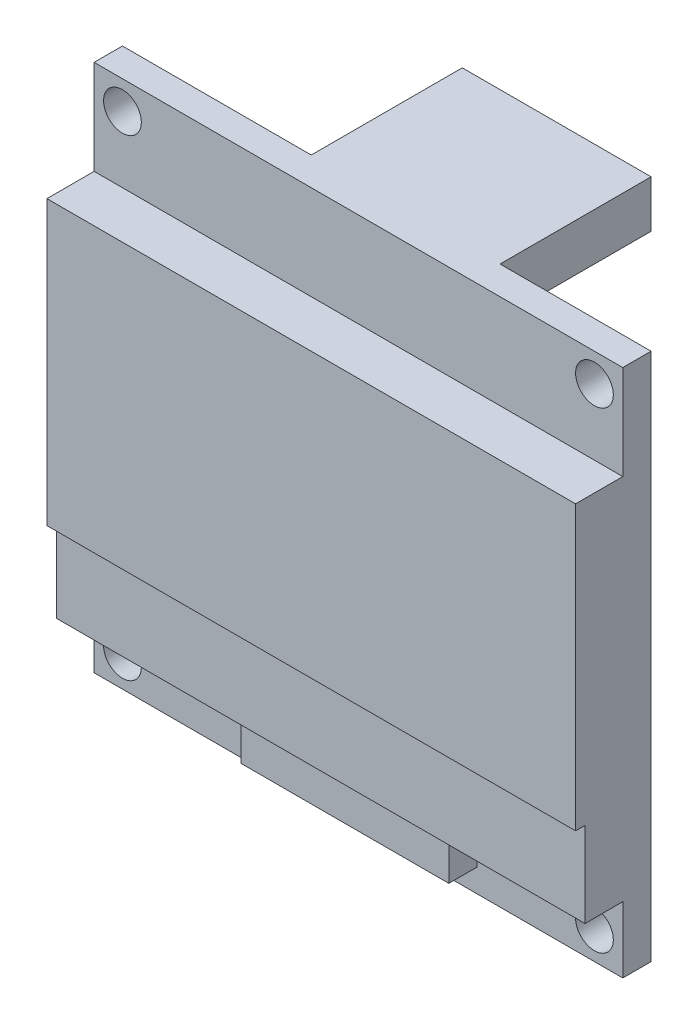
from build123d import *

# Parameters (mm, degrees)
SKETCH_1_W          = 28
SKETCH_1_H          = 28
EXTRUDE_3_DEPTH     = 1.5
SKETCH_3_W          = 28
SKETCH_3_H          = 19.5
EXTRUDE_4_DEPTH     = 2
SKETCH_5_W          = 28
SKETCH_5_H          = 15
EXTRUDE_5_DEPTH     = 0.5
SKETCH_6_W          = 11
SKETCH_6_H          = 2.266421477
EXTRUDE_6_DEPTH     = 1.5
SKETCH_7_R          = 1
CUT_EXTRUDE_4_DEPTH = 1.5
SKETCH_10_W         = 10
SKETCH_10_H         = 2.5
EXTRUDE_8_DEPTH     = 8


with BuildPart() as part:
    # Эскиз1 → Бобышка-Вытянуть3 (new body)
    with BuildSketch(Plane.XY):
        with Locations((14, 14)):
            Rectangle(SKETCH_1_W, SKETCH_1_H)
    extrude(amount=EXTRUDE_3_DEPTH)

    # Эскиз3 → Бобышка-Вытянуть4 (add)
    with BuildSketch(Plane.XY.offset(1.5)):
        with Locations((14, 13.25)):
            Rectangle(SKETCH_3_W, SKETCH_3_H)
    extrude(amount=EXTRUDE_4_DEPTH)

    # Эскиз5 → Бобышка-Вытянуть5 (add)
    with BuildSketch(Plane.XY.offset(3.5)):
        with Locations((14, 15.5)):
            Rectangle(SKETCH_5_W, SKETCH_5_H)
    extrude(amount=EXTRUDE_5_DEPTH)

    # Эскиз6 → Бобышка-Вытянуть6 (add)
    with BuildSketch(Plane.XY.offset(1.5)):
        with Locations((14.787482479, 2.366789262)):
            Rectangle(SKETCH_6_W, SKETCH_6_H)
    extrude(amount=EXTRUDE_6_DEPTH)

    # Эскиз7 → Вырез-Вытянуть4 (cut)
    with BuildSketch(Plane.XY.offset(1.5)):
        with Locations((1.5, 1.5)):
            Circle(SKETCH_7_R)
        with Locations((1.5, 26.5)):
            Circle(SKETCH_7_R)
        with Locations((26.5, 26.5)):
            Circle(SKETCH_7_R)
        with Locations((26.5, 1.5)):
            Circle(SKETCH_7_R)
    extrude(amount=-CUT_EXTRUDE_4_DEPTH, mode=Mode.SUBTRACT)

    # Эскиз10 → Бобышка-Вытянуть8 (add)
    with BuildSketch(Plane(origin=(0, 0, 0), x_dir=(-1, 0, 0), z_dir=(0, 0, -1))):
        with Locations((-15, 26.75)):
            Rectangle(SKETCH_10_W, SKETCH_10_H)
    extrude(amount=EXTRUDE_8_DEPTH)


solid = part.part
